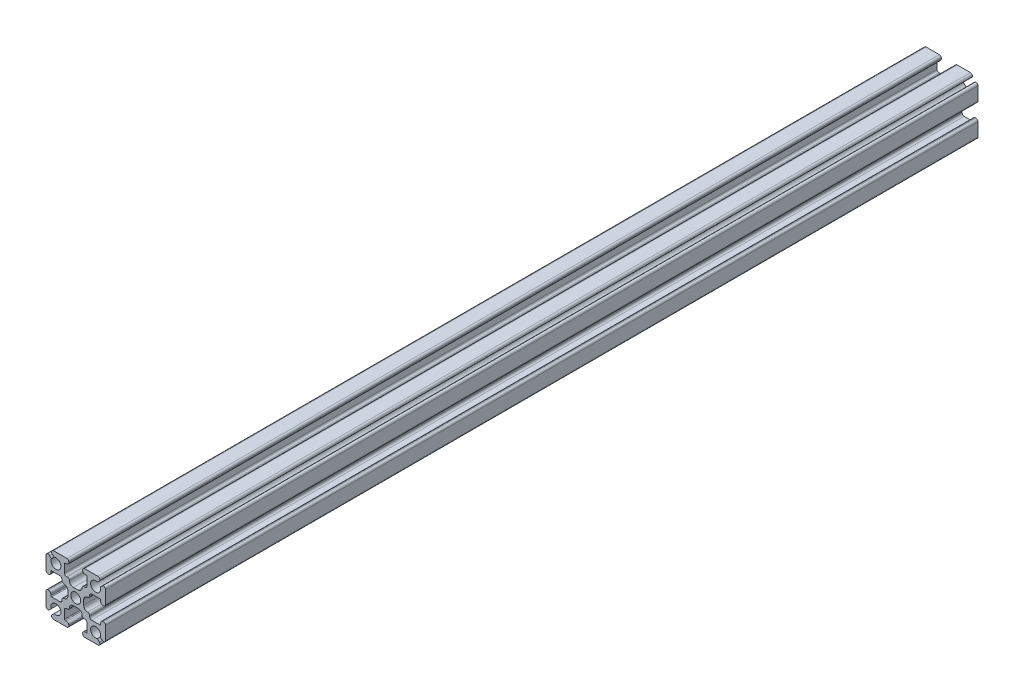
from build123d import *

# Parameters (mm, degrees)
SKETCH1_R           = 1.25
BOSS_EXTRUDE1_DEPTH = 220


with BuildPart() as part:
    # Sketch1 → Boss-Extrude1 (new body)
    with BuildSketch(Plane.XY):
        with BuildLine():
            Line((6.646446609, 5.939339828), (6.163645978, 5.456539197))
            ThreePointArc((6.163645978, 5.456539197), (4.116116524, 4.116116524), (5.456539197, 6.163645978))
            Line((5.456539197, 6.163645978), (5.939339828, 6.646446609))
            ThreePointArc((5.939339828, 6.646446609), (6.047726204, 7.191341716), (5.585786438, 7.5))
            Line((5.585786438, 7.5), (2.25, 7.5))
            ThreePointArc((2.25, 7.5), (1.896446609, 7.353553391), (1.75, 7))
            Line((1.75, 7), (1.75, 6.8))
            ThreePointArc((1.75, 6.8), (1.896446609, 6.446446609), (2.25, 6.3))
            Line((2.25, 6.3), (2.65, 6.3))
            ThreePointArc((2.65, 6.3), (2.791421356, 6.241421356), (2.85, 6.1))
            Line((2.85, 6.1), (2.85, 4))
            ThreePointArc((2.85, 4), (2.703553391, 3.646446609), (2.35, 3.5))
            Line((2.35, 3.5), (2.1, 3.5))
            ThreePointArc((2.1, 3.5), (1.746446609, 3.353553391), (1.6, 3))
            ThreePointArc((1.6, 3), (1.307106781, 2.292893219), (0.6, 2))
            Line((0.6, 2), (-0.6, 2))
            ThreePointArc((-0.6, 2), (-1.307106781, 2.292893219), (-1.6, 3))
            ThreePointArc((-1.6, 3), (-1.746446609, 3.353553391), (-2.1, 3.5))
            Line((-2.1, 3.5), (-2.35, 3.5))
            ThreePointArc((-2.35, 3.5), (-2.703553391, 3.646446609), (-2.85, 4))
            Line((-2.85, 4), (-2.85, 6.1))
            ThreePointArc((-2.85, 6.1), (-2.791421356, 6.241421356), (-2.65, 6.3))
            Line((-2.65, 6.3), (-2.25, 6.3))
            ThreePointArc((-2.25, 6.3), (-1.896446609, 6.446446609), (-1.75, 6.8))
            Line((-1.75, 6.8), (-1.75, 7))
            ThreePointArc((-1.75, 7), (-1.896446609, 7.353553391), (-2.25, 7.5))
            Line((-2.25, 7.5), (-5.585786438, 7.5))
            ThreePointArc((-5.585786438, 7.5), (-6.047726204, 7.191341716), (-5.939339828, 6.646446609))
            Line((-5.939339828, 6.646446609), (-5.456539197, 6.163645978))
            ThreePointArc((-5.456539197, 6.163645978), (-4.116116524, 4.116116524), (-6.163645978, 5.456539197))
            Line((-6.163645978, 5.456539197), (-6.646446609, 5.939339828))
            ThreePointArc((-6.646446609, 5.939339828), (-7.191341716, 6.047726204), (-7.5, 5.585786438))
            Line((-7.5, 5.585786438), (-7.5, 2.25))
            ThreePointArc((-7.5, 2.25), (-7.353553391, 1.896446609), (-7, 1.75))
            Line((-7, 1.75), (-6.8, 1.75))
            ThreePointArc((-6.8, 1.75), (-6.446446609, 1.896446609), (-6.3, 2.25))
            Line((-6.3, 2.25), (-6.3, 2.65))
            ThreePointArc((-6.3, 2.65), (-6.241421356, 2.791421356), (-6.1, 2.85))
            Line((-6.1, 2.85), (-4, 2.85))
            ThreePointArc((-4, 2.85), (-3.646446609, 2.703553391), (-3.5, 2.35))
            Line((-3.5, 2.35), (-3.5, 2.1))
            ThreePointArc((-3.5, 2.1), (-3.353553391, 1.746446609), (-3, 1.6))
            ThreePointArc((-3, 1.6), (-2.292893219, 1.307106781), (-2, 0.6))
            Line((-2, 0.6), (-2, -0.6))
            ThreePointArc((-2, -0.6), (-2.292893219, -1.307106781), (-3, -1.6))
            ThreePointArc((-3, -1.6), (-3.353553391, -1.746446609), (-3.5, -2.1))
            Line((-3.5, -2.1), (-3.5, -2.35))
            ThreePointArc((-3.5, -2.35), (-3.646446609, -2.703553391), (-4, -2.85))
            Line((-4, -2.85), (-6.1, -2.85))
            ThreePointArc((-6.1, -2.85), (-6.241421356, -2.791421356), (-6.3, -2.65))
            Line((-6.3, -2.65), (-6.3, -2.25))
            ThreePointArc((-6.3, -2.25), (-6.446446609, -1.896446609), (-6.8, -1.75))
            Line((-6.8, -1.75), (-7, -1.75))
            ThreePointArc((-7, -1.75), (-7.353553391, -1.896446609), (-7.5, -2.25))
            Line((-7.5, -2.25), (-7.5, -5.585786438))
            ThreePointArc((-7.5, -5.585786438), (-7.191341716, -6.047726204), (-6.646446609, -5.939339828))
            Line((-6.646446609, -5.939339828), (-6.163645978, -5.456539197))
            ThreePointArc((-6.163645978, -5.456539197), (-4.116116524, -4.116116524), (-5.456539197, -6.163645978))
            Line((-5.456539197, -6.163645978), (-5.939339828, -6.646446609))
            ThreePointArc((-5.939339828, -6.646446609), (-6.047726204, -7.191341716), (-5.585786438, -7.5))
            Line((-5.585786438, -7.5), (-2.25, -7.5))
            ThreePointArc((-2.25, -7.5), (-1.896446609, -7.353553391), (-1.75, -7))
            Line((-1.75, -7), (-1.75, -6.8))
            ThreePointArc((-1.75, -6.8), (-1.896446609, -6.446446609), (-2.25, -6.3))
            Line((-2.25, -6.3), (-2.65, -6.3))
            ThreePointArc((-2.65, -6.3), (-2.791421356, -6.241421356), (-2.85, -6.1))
            Line((-2.85, -6.1), (-2.85, -4))
            ThreePointArc((-2.85, -4), (-2.703553391, -3.646446609), (-2.35, -3.5))
            Line((-2.35, -3.5), (-2.1, -3.5))
            ThreePointArc((-2.1, -3.5), (-1.746446609, -3.353553391), (-1.6, -3))
            ThreePointArc((-1.6, -3), (-1.307106781, -2.292893219), (-0.6, -2))
            Line((-0.6, -2), (0.6, -2))
            ThreePointArc((0.6, -2), (1.307106781, -2.292893219), (1.6, -3))
            ThreePointArc((1.6, -3), (1.746446609, -3.353553391), (2.1, -3.5))
            Line((2.1, -3.5), (2.35, -3.5))
            ThreePointArc((2.35, -3.5), (2.703553391, -3.646446609), (2.85, -4))
            Line((2.85, -4), (2.85, -6.1))
            ThreePointArc((2.85, -6.1), (2.791421356, -6.241421356), (2.65, -6.3))
            Line((2.65, -6.3), (2.25, -6.3))
            ThreePointArc((2.25, -6.3), (1.896446609, -6.446446609), (1.75, -6.8))
            Line((1.75, -6.8), (1.75, -7))
            ThreePointArc((1.75, -7), (1.896446609, -7.353553391), (2.25, -7.5))
            Line((2.25, -7.5), (5.585786438, -7.5))
            ThreePointArc((5.585786438, -7.5), (6.047726204, -7.191341716), (5.939339828, -6.646446609))
            Line((5.939339828, -6.646446609), (5.456539197, -6.163645978))
            ThreePointArc((5.456539197, -6.163645978), (4.116116524, -4.116116524), (6.163645978, -5.456539197))
            Line((6.163645978, -5.456539197), (6.646446609, -5.939339828))
            ThreePointArc((6.646446609, -5.939339828), (7.191341716, -6.047726204), (7.5, -5.585786438))
            Line((7.5, -5.585786438), (7.5, -2.25))
            ThreePointArc((7.5, -2.25), (7.353553391, -1.896446609), (7, -1.75))
            Line((7, -1.75), (6.8, -1.75))
            ThreePointArc((6.8, -1.75), (6.446446609, -1.896446609), (6.3, -2.25))
            Line((6.3, -2.25), (6.3, -2.65))
            ThreePointArc((6.3, -2.65), (6.241421356, -2.791421356), (6.1, -2.85))
            Line((6.1, -2.85), (4, -2.85))
            ThreePointArc((4, -2.85), (3.646446609, -2.703553391), (3.5, -2.35))
            Line((3.5, -2.35), (3.5, -2.1))
            ThreePointArc((3.5, -2.1), (3.353553391, -1.746446609), (3, -1.6))
            ThreePointArc((3, -1.6), (2.292893219, -1.307106781), (2, -0.6))
            Line((2, -0.6), (2, 0.6))
            ThreePointArc((2, 0.6), (2.292893219, 1.307106781), (3, 1.6))
            ThreePointArc((3, 1.6), (3.353553391, 1.746446609), (3.5, 2.1))
            Line((3.5, 2.1), (3.5, 2.35))
            ThreePointArc((3.5, 2.35), (3.646446609, 2.703553391), (4, 2.85))
            Line((4, 2.85), (6.1, 2.85))
            ThreePointArc((6.1, 2.85), (6.241421356, 2.791421356), (6.3, 2.65))
            Line((6.3, 2.65), (6.3, 2.25))
            ThreePointArc((6.3, 2.25), (6.446446609, 1.896446609), (6.8, 1.75))
            Line((6.8, 1.75), (7, 1.75))
            ThreePointArc((7, 1.75), (7.353553391, 1.896446609), (7.5, 2.25))
            Line((7.5, 2.25), (7.5, 5.585786438))
            ThreePointArc((7.5, 5.585786438), (7.191341716, 6.047726204), (6.646446609, 5.939339828))
        make_face()
        Circle(SKETCH1_R, mode=Mode.SUBTRACT)
    extrude(amount=BOSS_EXTRUDE1_DEPTH)


solid = part.part
